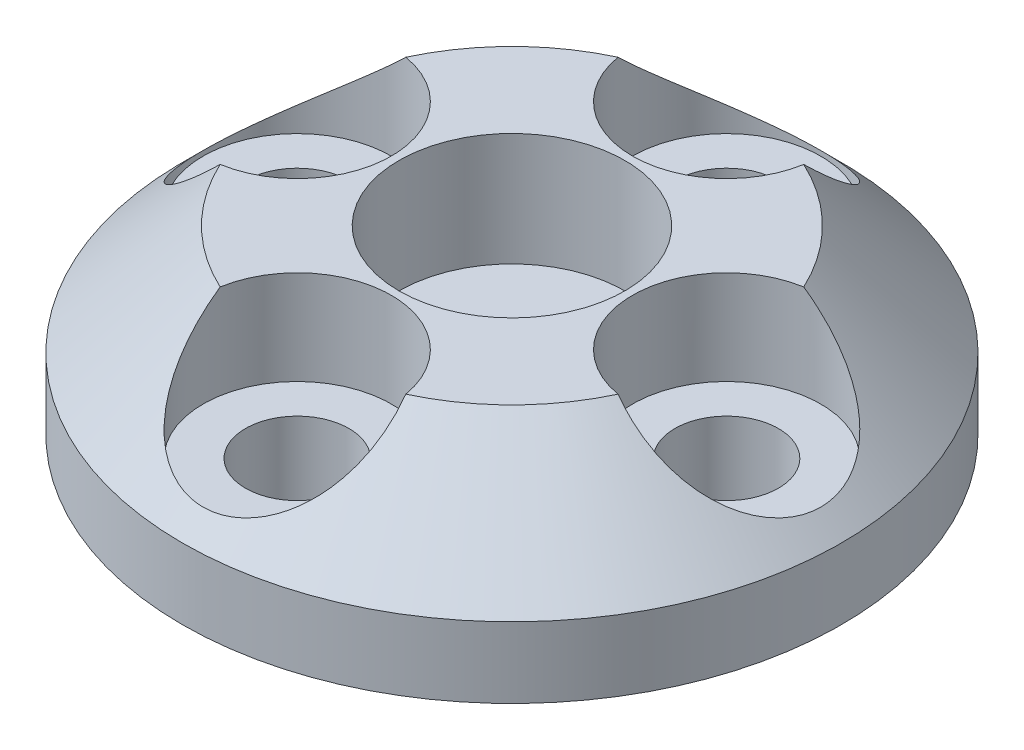
from build123d import *

# Parameters (mm, degrees)
SKETCH1_R           = 8.75
BOSS_EXTRUDE1_DEPTH = 4.8
SKETCH2_R           = 3
CUT_EXTRUDE1_DEPTH  = 3
SKETCH3_R           = 2.5
CUT_EXTRUDE2_DEPTH  = 2.5
SKETCH4_R           = 1.375
CUT_EXTRUDE3_DEPTH  = 2.5
CHAMFER1_SIZE       = 2.921


with BuildPart() as part:
    # Sketch1 → Boss-Extrude1 (new body)
    with BuildSketch(Plane(origin=(0, 0, 0), x_dir=(1, 0, 0), z_dir=(0, 1, 0))):
        with Locations(Location((0, 0, 0), (0, 0, 270))):
            Circle(SKETCH1_R)
    extrude(amount=BOSS_EXTRUDE1_DEPTH)

    # Sketch2 → Cut-Extrude1 (cut)
    with BuildSketch(Plane(origin=(0, 4.8, 0), x_dir=(1, 0, 0), z_dir=(0, 1, 0))):
        with Locations(Location((0, 0, 0), (0, 0, 270))):
            Circle(SKETCH2_R)
    extrude(amount=-CUT_EXTRUDE1_DEPTH, mode=Mode.SUBTRACT)

    # Sketch3 → Cut-Extrude2 (cut)
    with BuildSketch(Plane(origin=(0, 4.8, 0), x_dir=(1, 0, 0), z_dir=(0, 1, 0))):
        with Locations(Location((-5.7, 0, 0), (0, 0, 270))):
            Circle(SKETCH3_R)
        with Locations(Location((0, 5.7, 0), (0, 0, 270))):
            Circle(SKETCH3_R)
        with Locations(Location((5.7, 0, 0), (0, 0, 270))):
            Circle(SKETCH3_R)
        with Locations(Location((0, -5.7, 0), (0, 0, 270))):
            Circle(SKETCH3_R)
    extrude(amount=-CUT_EXTRUDE2_DEPTH, mode=Mode.SUBTRACT)

    # Sketch4 → Cut-Extrude3 (cut)
    with BuildSketch(Plane(origin=(0, 2.3, 0), x_dir=(1, 0, 0), z_dir=(0, 1, 0))):
        with Locations(Location((-5.7, 0, 0), (0, 0, 270))):
            Circle(SKETCH4_R)
        with Locations(Location((0, 5.7, 0), (0, 0, 270))):
            Circle(SKETCH4_R)
        with Locations(Location((5.7, 0, 0), (0, 0, 270))):
            Circle(SKETCH4_R)
        with Locations(Location((0, -5.7, 0), (0, 0, 270))):
            Circle(SKETCH4_R)
    extrude(amount=-CUT_EXTRUDE3_DEPTH, mode=Mode.SUBTRACT)

    # Chamfer1
    # the kernel refuses this chamfer: 2.921 mm, written as the material it takes off along each edge
    with BuildSketch(Plane(origin=(0, 4.8, 0), x_dir=(0, 0, 1), z_dir=(-1, 0, 0))) as chamfer1_piece_1:
        Polygon((8.75, -CHAMFER1_SIZE), (8.75 - CHAMFER1_SIZE, 0), (8.75, 0), align=None)
    revolve(axis=Axis((0, 4.8, 0), (0, 1, 0)), mode=Mode.SUBTRACT)


solid = part.part
